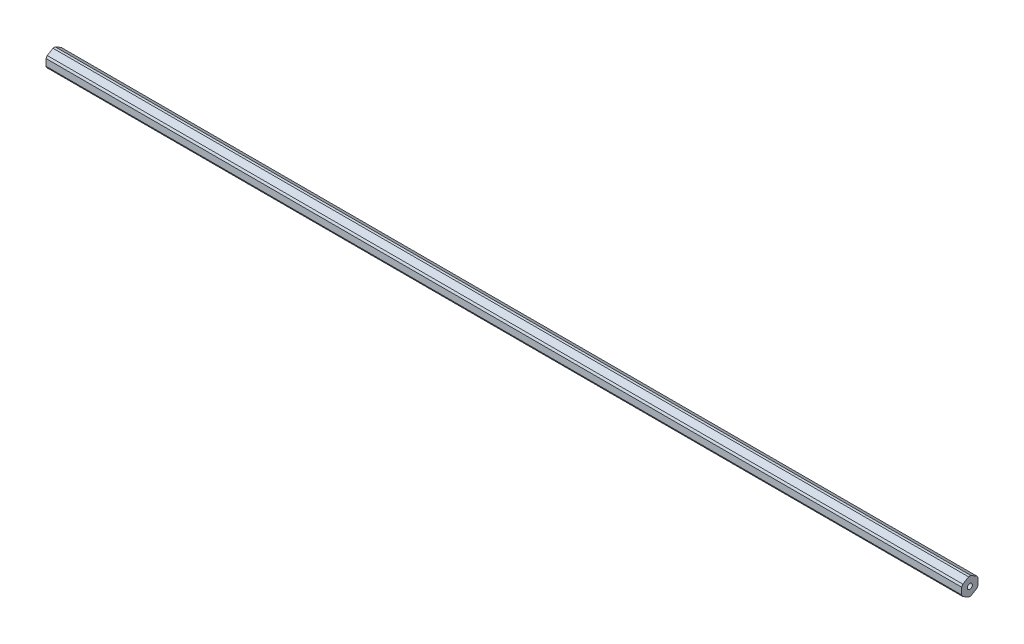
from build123d import *

# Parameters (mm, degrees)
SKETCH1_R           = 1.9939
BOSS_EXTRUDE1_DEPTH = 355.6


with BuildPart() as part:
    # Sketch1 → Boss-Extrude1 (new, symmetric)
    with BuildSketch(Plane(origin=(914.4, 0, 0), x_dir=(0, 0, -1), z_dir=(1, 0, 0))):
        with BuildLine():
            Line((-5.43426841, -4.194872089), (-0.91573159, -6.803650539))
            ThreePointArc((-0.91573159, -6.803650539), (0, -6.865), (0.91573159, -6.803650539))
            Line((0.91573159, -6.803650539), (5.43426841, -4.194872089))
            ThreePointArc((5.43426841, -4.194872089), (5.945264397, -3.4325), (6.35, -2.60877845))
            Line((6.35, -2.60877845), (6.35, 2.60877845))
            ThreePointArc((6.35, 2.60877845), (5.945264397, 3.4325), (5.43426841, 4.194872089))
            Line((5.43426841, 4.194872089), (0.91573159, 6.803650539))
            ThreePointArc((0.91573159, 6.803650539), (0, 6.865), (-0.91573159, 6.803650539))
            Line((-0.91573159, 6.803650539), (-5.43426841, 4.194872089))
            ThreePointArc((-5.43426841, 4.194872089), (-5.945264397, 3.4325), (-6.35, 2.60877845))
            Line((-6.35, 2.60877845), (-6.35, -2.60877845))
            ThreePointArc((-6.35, -2.60877845), (-5.945264397, -3.4325), (-5.43426841, -4.194872089))
        make_face()
        Circle(SKETCH1_R, mode=Mode.SUBTRACT)
    extrude(amount=BOSS_EXTRUDE1_DEPTH, both=True)


solid = part.part
